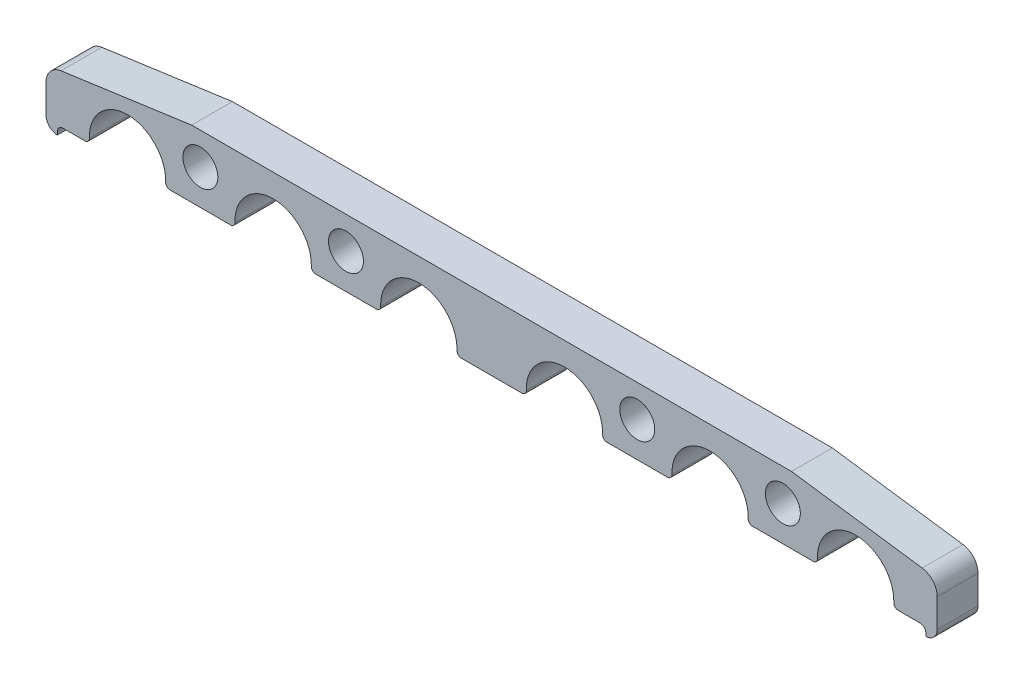
from build123d import *

# Parameters (mm, degrees)
ESQUISSE1_W                  = 306
ESQUISSE1_H                  = 26
BOSS_EXTRU_1_DEPTH           = 14
ENL_V_MAT_EXTRU_1_DEPTH      = 14.1
CONG_1_R                     = 1.5
CONG_2_R                     = 2
ENL_V_MAT_EXTRU_2_DEPTH      = 308.421534704
ENL_V_MAT_EXTRU_2_DEPTH_BACK = 308.421534704
CONG_3_R                     = 6
CONG_4_R                     = 4
ENL_V_MAT_EXTRU_3_DEPTH      = 308.421534704
ENL_V_MAT_EXTRU_3_DEPTH_BACK = 10
ESQUISSE4_R                  = 2.95
ESQUISSE6_R                  = 2.15
ENL_V_MAT_EXTRU_5_DEPTH      = 5.5
ENL_V_MAT_EXTRU_6_DEPTH      = 308.421534704
ENL_V_MAT_EXTRU_6_DEPTH_BACK = 308.421534704
ESQUISSE7_R                  = 6
ESQUISSE8_R                  = 3.65
ENL_V_MAT_EXTRU_7_DEPTH      = 1.3


with BuildPart() as part:
    # Esquisse1 → Boss.-Extru.1 (new body)
    with BuildSketch(Plane.XY):
        with Locations((153, 13)):
            Rectangle(ESQUISSE1_W, ESQUISSE1_H)
    extrude(amount=BOSS_EXTRU_1_DEPTH)

    # Esquisse2 → Enlèv. mat.-Extru.1 (cut)
    with BuildSketch(Plane.XY.offset(14)):
        with BuildLine():
            Line((215.053571921, 3), (190.946428079, 3))
            ThreePointArc((190.946428079, 3), (178, 18.1), (165.053571921, 3))
            Line((165.053571921, 3), (140.946428079, 3))
            ThreePointArc((140.946428079, 3), (128, 18.1), (115.053571921, 3))
            Line((115.053571921, 3), (90.946428079, 3))
            ThreePointArc((90.946428079, 3), (78, 18.1), (65.053571921, 3))
            Line((65.053571921, 3), (40.946428079, 3))
            ThreePointArc((40.946428079, 3), (28, 18.1), (15.053571921, 3))
            Line((15.053571921, 3), (3.9, 3))
            Line((3.9, 3), (3.9, 0))
            Line((3.9, 0), (302.1, 0))
            Line((302.1, 0), (302.1, 3))
            Line((302.1, 3), (290.946428079, 3))
            ThreePointArc((290.946428079, 3), (278, 18.1), (265.053571921, 3))
            Line((265.053571921, 3), (240.946428079, 3))
            ThreePointArc((240.946428079, 3), (228, 18.1), (215.053571921, 3))
        make_face()
    extrude(amount=-ENL_V_MAT_EXTRU_1_DEPTH, mode=Mode.SUBTRACT)

    # Congé1
    cong_1_edges = [part.edges().sort_by_distance(p)[0] for p in [
        (165.053571921, 3, 7),
        (190.946428079, 3, 7),
        (215.053571921, 3, 7),
        (240.946428079, 3, 7),
        (265.053571921, 3, 7),
        (290.946428079, 3, 7),
        (15.053571921, 3, 7),
        (40.946428079, 3, 7),
        (65.053571921, 3, 7),
        (90.946428079, 3, 7),
        (115.053571921, 3, 7),
        (140.946428079, 3, 7),
    ]]
    fillet(cong_1_edges, radius=CONG_1_R)

    # Congé2
    cong_2_edges = [part.edges().sort_by_distance(p)[0] for p in [
        (302.1, 3, 7),
        (3.9, 3, 7),
    ]]
    fillet(cong_2_edges, radius=CONG_2_R)

    # Esquisse3 → Enlèv. mat.-Extru.2 (cut, two sides: drawn at the far end of the back side and taken through both)
    with BuildSketch(Plane.XY.offset(14).offset(-ENL_V_MAT_EXTRU_2_DEPTH_BACK)):
        Polygon((0, 19), (50, 26), (0, 26), align=None)
        Polygon((306, 26), (306, 19), (256, 26), align=None)
    extrude(amount=ENL_V_MAT_EXTRU_2_DEPTH + ENL_V_MAT_EXTRU_2_DEPTH_BACK, mode=Mode.SUBTRACT)

    # Congé3
    cong_3_edges = [part.edges().sort_by_distance(p)[0] for p in [
        (0, 19, 7),
        (306, 19, 7),
    ]]
    fillet(cong_3_edges, radius=CONG_3_R)

    # Congé4
    # the kernel refuses this fillet: 4 mm, written as the material it takes off along each edge
    with BuildSketch(Plane(origin=(306, 0, -9.996874512), x_dir=(0, 1, 0), z_dir=(0, 0, 1))) as cong_4_piece_1:
        with BuildLine():
            CenterArc((3.998749805, 4), CONG_4_R, 181.432543738, 88.567456262)
            Line((0, 3.9), (-0.079974996, 3.898))
            ThreePointArc((-0.079974996, 3.898), (-0.08, 1.95), (-0.08, 0))
            Line((-0.08, 0), (0, -0.08))
            Line((0, -0.08), (3.998749805, -0.08))
            Line((3.998749805, -0.08), (3.998749805, 0))
        make_face()
    extrude(amount=33.993749023, mode=Mode.SUBTRACT)
    with BuildSketch(Plane(origin=(0, 0, -9.996874512), x_dir=(0, 1, 0), z_dir=(0, 0, 1))) as cong_4_piece_2:
        with BuildLine():
            CenterArc((3.998749805, -4), CONG_4_R, 90, 88.567456262)
            Line((0, -3.9), (-0.079974996, -3.898))
            ThreePointArc((-0.079974996, -3.898), (-0.08, -1.95), (-0.08, 0))
            Line((-0.08, 0), (0, 0.08))
            Line((0, 0.08), (3.998749805, 0.08))
            Line((3.998749805, 0.08), (3.998749805, 0))
        make_face()
    extrude(amount=33.993749023, mode=Mode.SUBTRACT)

    # Esquisse4 → Enlèv. mat.-Extru.3 (cut, two sides: drawn at the far end of the back side and taken through both)
    with BuildSketch(Plane(origin=(0, 0, 0), x_dir=(-1, 0, 0), z_dir=(0, 0, -1)).offset(-ENL_V_MAT_EXTRU_3_DEPTH_BACK)):
        with Locations((-153, 20.5)):
            Circle(ESQUISSE4_R)
        with Locations(Location((-153, 8.5, 0), (0, 0, 180))):
            Circle(ESQUISSE4_R)
    extrude(amount=ENL_V_MAT_EXTRU_3_DEPTH + ENL_V_MAT_EXTRU_3_DEPTH_BACK, mode=Mode.SUBTRACT)

    # Esquisse6 → Enlèv. mat.-Extru.5 (cut)
    with BuildSketch(Plane.XZ.offset(-3)):
        with Locations(Location((298, 7, 0), (0, 0, 270))):
            Circle(ESQUISSE6_R)
        with Locations(Location((8, 7, 0), (0, 0, 192.380798917))):
            Circle(ESQUISSE6_R)
        with Locations(Location((103, 7, 0), (0, 0, 270))):
            Circle(ESQUISSE6_R)
        with Locations(Location((203, 7, 0), (0, 0, 90))):
            Circle(ESQUISSE6_R)
    extrude(amount=-ENL_V_MAT_EXTRU_5_DEPTH, mode=Mode.SUBTRACT)

    # Esquisse7 → Enlèv. mat.-Extru.6 (cut, two sides: drawn at the far end of the back side and taken through both)
    with BuildSketch(Plane.XY.offset(14).offset(-ENL_V_MAT_EXTRU_6_DEPTH_BACK)):
        with Locations(Location((53, 15, 0), (0, 0, 180))):
            Circle(ESQUISSE7_R)
        with Locations(Location((103, 15, 0), (0, 0, 180))):
            Circle(ESQUISSE7_R)
        with Locations(Location((203, 15, 0), (0, 0, 180))):
            Circle(ESQUISSE7_R)
        with Locations(Location((253, 15, 0), (0, 0, 180))):
            Circle(ESQUISSE7_R)
    extrude(amount=ENL_V_MAT_EXTRU_6_DEPTH + ENL_V_MAT_EXTRU_6_DEPTH_BACK, mode=Mode.SUBTRACT)

    # Esquisse8 → Enlèv. mat.-Extru.7 (cut)
    with BuildSketch(Plane(origin=(0, 0, 0), x_dir=(-1, 0, 0), z_dir=(0, 0, -1))):
        with Locations((-153, 20.5)):
            Circle(ESQUISSE8_R)
        with Locations((-153, 8.5)):
            Circle(ESQUISSE8_R)
    extrude(amount=-ENL_V_MAT_EXTRU_7_DEPTH, mode=Mode.SUBTRACT)


solid = part.part
